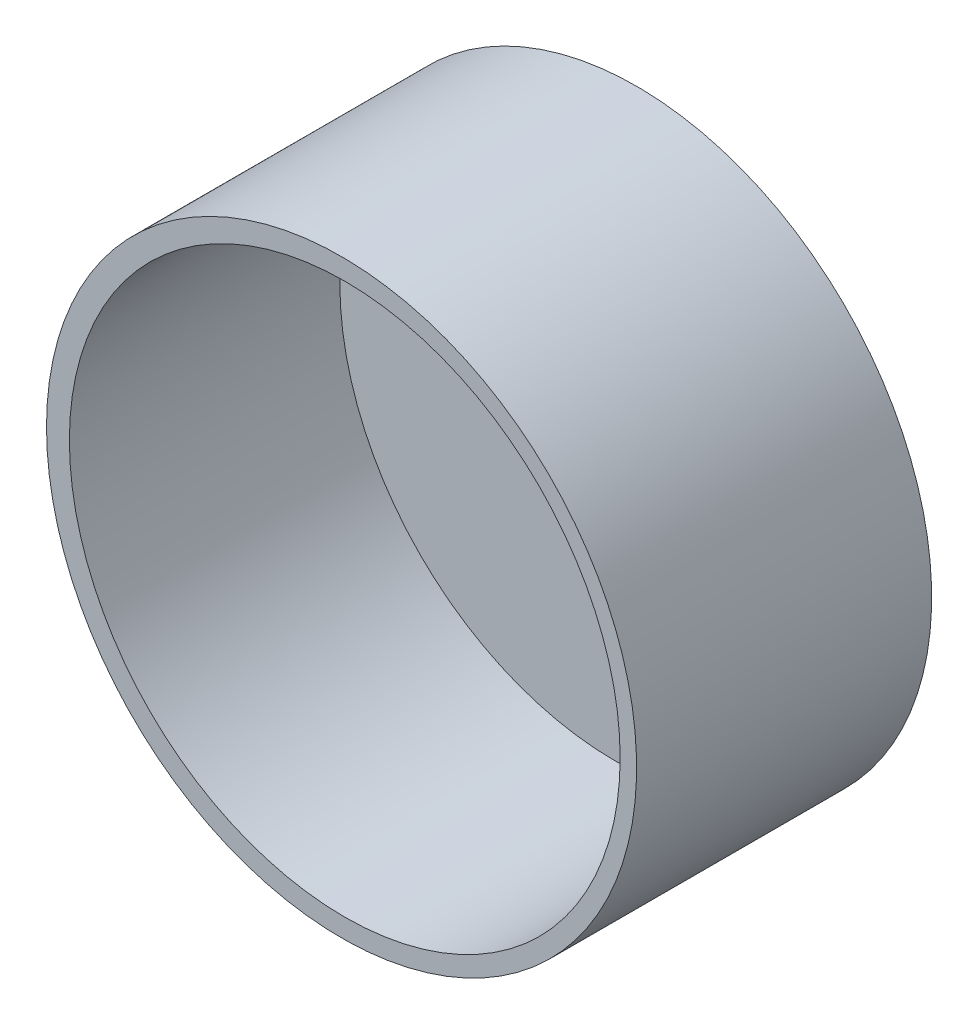
from build123d import *

# Parameters (mm, degrees)
SKETCH1_R           = 76.2
SKETCH1_R_2         = 71.12
BOSS_EXTRUDE1_DEPTH = 76.2
SKETCH3_R           = 76.2
BOSS_EXTRUDE2_DEPTH = 6.35
SKETCH4_R           = 19.05
CUT_EXTRUDE1_DEPTH  = 2.54


with BuildPart() as part:
    # Sketch1 → Boss-Extrude1 (new body)
    with BuildSketch(Plane.XY):
        Circle(SKETCH1_R)
        with Locations((0.828825483, 0)):
            Circle(SKETCH1_R_2, mode=Mode.SUBTRACT)
    extrude(amount=BOSS_EXTRUDE1_DEPTH)

    # Sketch3 → Boss-Extrude2 (add)
    with BuildSketch(Plane.XY):
        Circle(SKETCH3_R)
    extrude(amount=BOSS_EXTRUDE2_DEPTH)

    # Sketch4 → Cut-Extrude1 (cut)
    with BuildSketch(Plane.XY.offset(6.35)):
        Circle(SKETCH4_R)
    extrude(amount=-CUT_EXTRUDE1_DEPTH, mode=Mode.SUBTRACT)


solid = part.part
